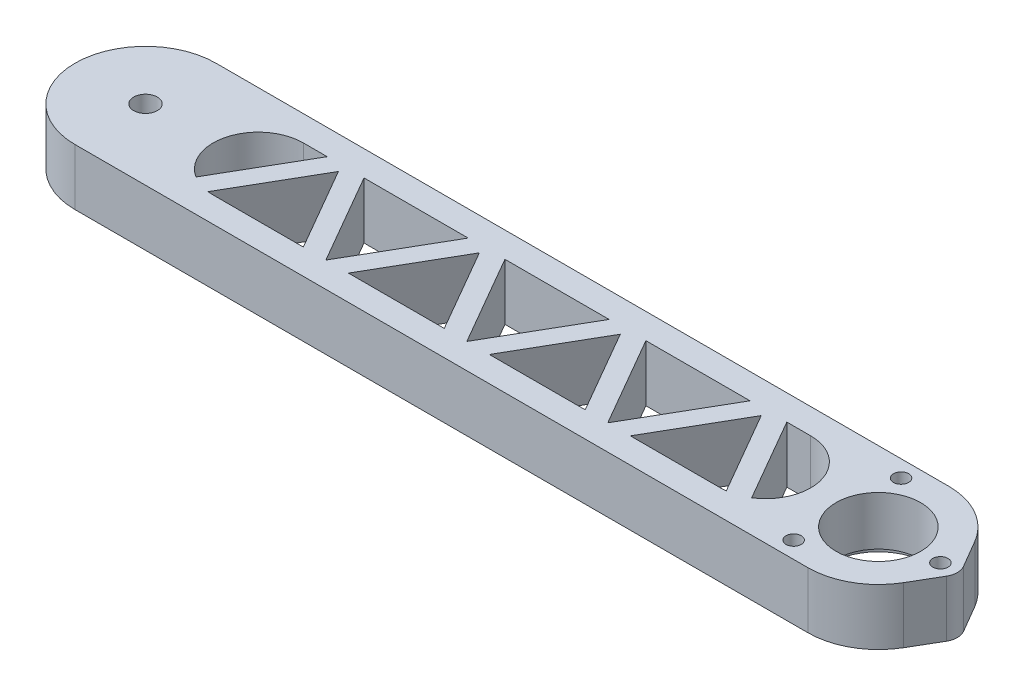
from build123d import *

# Parameters (mm, degrees)
EXTRUDE_1_DEPTH        = 10
EXTRUDE_5_DEPTH        = 10
CUT_EXTRUDE_2_REACH    = 82.606
SKETCH_7_R             = 7.5
SKETCH_8_R             = 8.75
CUT_EXTRUDE_3_DEPTH    = 1.3
CUT_EXTRUDE_4_REACH    = 82.606
SKETCH_9_R             = 1.35
CUT_EXTRUDE_5_REACH    = 82.606
SKETCH_12_R            = 2.1
CUT_EXTRUDE_6_REACH    = 82.606
EXTRUDE_6_DEPTH        = 10
PATTERN_LINEAR_1_DEPTH = 10


# Read off the part's stored shape, not the designer's step: 阵列(线性)1
with BuildPart() as part:
    # 草图1 → 凸台-拉伸1 (new body)
    with BuildSketch(Plane(origin=(0, 0, 0), x_dir=(1, 0, 0), z_dir=(0, 1, 0))):
        with BuildLine():
            Line((-65, 12.5), (65, 12.5))
            ThreePointArc((65, 12.5), (77.5, 0), (65, -12.5))
            Line((65, -12.5), (-65, -12.5))
            ThreePointArc((-65, -12.5), (-77.5, 0), (-65, 12.5))
        make_face()
    extrude(amount=EXTRUDE_1_DEPTH)

    # 草图10 → 凸台-拉伸5 (add)
    with BuildSketch(Plane.XZ):
        with BuildLine():
            Line((75.795454545, -6.301441197), (78.590909091, -1.512345887))
            ThreePointArc((78.590909091, -1.512345887), (79, 0), (78.590909091, 1.512345887))
            Line((78.590909091, 1.512345887), (75.795454545, 6.301441197))
            Line((75.795454545, 6.301441197), (75.795454545, -6.301441197))
        make_face()
    extrude(amount=-EXTRUDE_5_DEPTH)

    # 草图7 → 切除-拉伸2 (cut, up to next)
    with BuildSketch(Plane(origin=(0, 10, 0), x_dir=(1, 0, 0), z_dir=(0, 1, 0)), mode=Mode.PRIVATE) as cut_extrude_2_sk1:
        with Locations(Location((65, 0, 0), (0, 0, 270))):
            Circle(SKETCH_7_R)
    cut_extrude_2_tool1 = extrude(cut_extrude_2_sk1.sketch, amount=-CUT_EXTRUDE_2_REACH, mode=Mode.PRIVATE) & part.part
    add(cut_extrude_2_tool1.solids().sort_by_distance((65, 10, 0))[0], mode=Mode.SUBTRACT)

    # 草图8 → 切除-拉伸3 (cut)
    with BuildSketch(Plane(origin=(0, 0, 0), x_dir=(1, 0, 0), z_dir=(0, 1, 0))):
        with Locations(Location((65, 0, 0), (0, 0, 270))):
            Circle(SKETCH_8_R)
    extrude(amount=CUT_EXTRUDE_3_DEPTH, mode=Mode.SUBTRACT)

    # 草图9 → 切除-拉伸4 (cut, up to next)
    with BuildSketch(Plane.XZ, mode=Mode.PRIVATE) as cut_extrude_4_sk1:
        with Locations(Location((59.5, 9.526279442, 0), (0, 0, 270))):
            Circle(SKETCH_9_R)
    cut_extrude_4_tool1 = extrude(cut_extrude_4_sk1.sketch, amount=-CUT_EXTRUDE_4_REACH, mode=Mode.PRIVATE) & part.part
    # 草图9 → 切除-拉伸4 (cut, up to next)
    with BuildSketch(Plane.XZ, mode=Mode.PRIVATE) as cut_extrude_4_sk2:
        with Locations(Location((76, 0, 0), (0, 0, 270))):
            Circle(SKETCH_9_R)
    cut_extrude_4_tool2 = extrude(cut_extrude_4_sk2.sketch, amount=-CUT_EXTRUDE_4_REACH, mode=Mode.PRIVATE) & part.part
    # 草图9 → 切除-拉伸4 (cut, up to next)
    with BuildSketch(Plane.XZ, mode=Mode.PRIVATE) as cut_extrude_4_sk3:
        with Locations(Location((59.5, -9.526279442, 0), (0, 0, 270))):
            Circle(SKETCH_9_R)
    cut_extrude_4_tool3 = extrude(cut_extrude_4_sk3.sketch, amount=-CUT_EXTRUDE_4_REACH, mode=Mode.PRIVATE) & part.part
    add(cut_extrude_4_tool1.solids().sort_by_distance((59.5, 0, 9.526279))[0], mode=Mode.SUBTRACT)
    add(cut_extrude_4_tool2.solids().sort_by_distance((76, 0, 0))[0], mode=Mode.SUBTRACT)
    add(cut_extrude_4_tool3.solids().sort_by_distance((59.5, 0, -9.526279))[0], mode=Mode.SUBTRACT)

    # 草图12 → 切除-拉伸5 (cut, up to next)
    with BuildSketch(Plane(origin=(0, 10, 0), x_dir=(1, 0, 0), z_dir=(0, 1, 0)), mode=Mode.PRIVATE) as cut_extrude_5_sk1:
        with Locations(Location((-65, 0, 0), (0, 0, 270))):
            Circle(SKETCH_12_R)
    cut_extrude_5_tool1 = extrude(cut_extrude_5_sk1.sketch, amount=-CUT_EXTRUDE_5_REACH, mode=Mode.PRIVATE) & part.part
    add(cut_extrude_5_tool1.solids().sort_by_distance((-65, 10, 0))[0], mode=Mode.SUBTRACT)

    # 草图13 → 切除-拉伸6 (cut, up to next)
    with BuildSketch(Plane(origin=(0, 10, 0), x_dir=(1, 0, 0), z_dir=(0, 1, 0)), mode=Mode.PRIVATE) as cut_extrude_6_sk1:
        with BuildLine():
            Line((-45, 8), (45, 8))
            ThreePointArc((45, 8), (53, 0), (45, -8))
            Line((45, -8), (-45, -8))
            ThreePointArc((-45, -8), (-53, 0), (-45, 8))
        make_face()
    cut_extrude_6_tool1 = extrude(cut_extrude_6_sk1.sketch, amount=-CUT_EXTRUDE_6_REACH, mode=Mode.PRIVATE) & part.part
    add(cut_extrude_6_tool1.solids().sort_by_distance((0, 10, 0))[0], mode=Mode.SUBTRACT)

    # 草图14 → 凸台-拉伸6 (add)
    with BuildSketch(Plane(origin=(0, 10, 0), x_dir=(1, 0, 0), z_dir=(0, 1, 0))):
        Polygon((0, -8), (9.237604307, 8), (13.237604307, 8), (4, -8), align=None)
    extrude_6 = extrude(amount=-EXTRUDE_6_DEPTH)

    # 阵列(线性)1 outline → 阵列(线性)1 (add)
    with BuildSketch(Plane(origin=(0, 0, 0), x_dir=(1, 0, 0), z_dir=(0, 1, 0))):
        Polygon((38.237604307, 8), (34.237604307, 8), (25, -8), (29, -8), align=None)
        Polygon((-11.762395693, 8), (-15.762395693, 8), (-25, -8), (-21, -8), align=None)
        with BuildLine():
            Line((-45.966190603, -7.941440406), (-36.762395693, 8))
            Line((-36.762395693, 8), (-40.762395693, 8))
            Line((-40.762395693, 8), (-49.282491188, -6.757238284))
            ThreePointArc((-49.282491188, -6.757238284), (-47.690306451, -7.534072683), (-45.966190603, -7.941440406))
        make_face()
    pattern_linear_1 = extrude(amount=PATTERN_LINEAR_1_DEPTH)

    # 镜向1: 凸台-拉伸6, 阵列(线性)1 across plane
    add(extrude_6.mirror(Plane(origin=(0, 0, 0), x_dir=(0, 0, 1), z_dir=(1, 0, 0))))
    add(pattern_linear_1.mirror(Plane(origin=(0, 0, 0), x_dir=(0, 0, 1), z_dir=(1, 0, 0))))


solid = part.part
